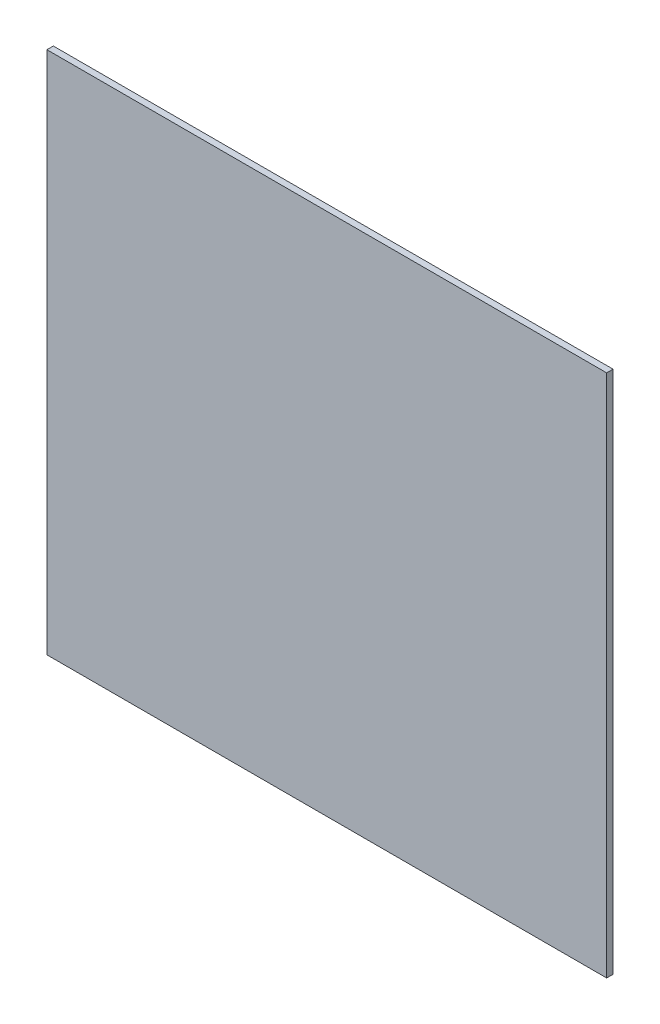
from build123d import *

# Parameters (mm, degrees)
SKETCH_1_W      = 524
SKETCH_1_H      = 490.6
EXTRUDE_1_DEPTH = 6


with BuildPart() as part:
    # Эскиз1 → Бобышка-Вытянуть1 (new body)
    with BuildSketch(Plane.XY):
        with Locations((-262, -239.3)):
            Rectangle(SKETCH_1_W, SKETCH_1_H)
    extrude(amount=-EXTRUDE_1_DEPTH)


solid = part.part
